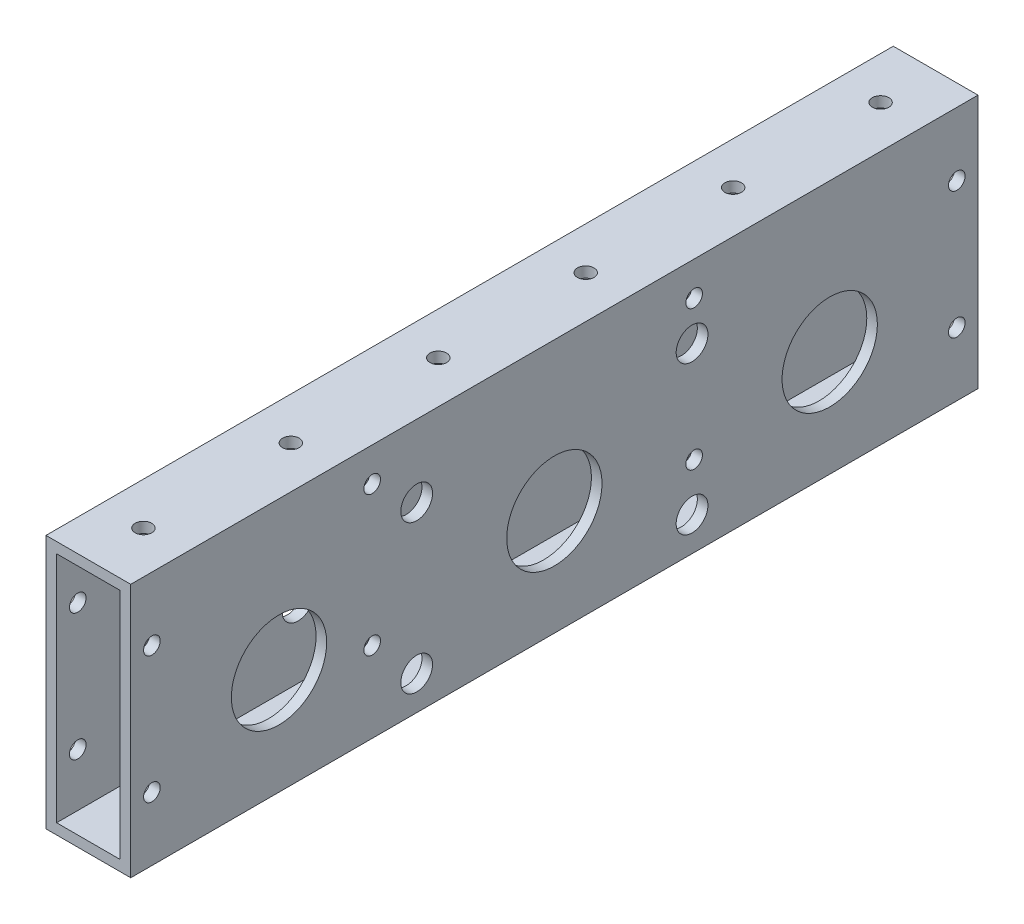
from build123d import *

# Parameters (mm, degrees)
SKETCH1_W                        = 254
SKETCH1_H                        = 76.2
BOSS_EXTRUDE1_DEPTH              = 25.4
SHELL1_T                         = -3.175
SKETCH2_R                        = 14.2875
SKETCH2_R_2                      = 2.4892
CUT_EXTRUDE1_DEPTH               = 136.002851822
F_10_CLEARANCE_HOLE1_D           = 4.9784
F_3_8_0_375_DIAMETER_HOLE1_D     = 9.525
F_3_8_0_375_DIAMETER_HOLE1_DEPTH = 10.922
F_3_8_0_375_DIAMETER_HOLE1_TIP   = 2.861598698
F_3_8_0_375_DIAMETER_HOLE2_D     = 9.525
F_3_8_0_375_DIAMETER_HOLE2_DEPTH = 10.922
F_3_8_0_375_DIAMETER_HOLE2_TIP   = 2.861598698
SKETCH11_R                       = 2.4892
CUT_EXTRUDE2_DEPTH               = 151.268426491


with BuildPart() as part:
    # Sketch1 → Boss-Extrude1 (new body)
    with BuildSketch(Plane(origin=(0, 0, 0), x_dir=(0, 0, -1), z_dir=(1, 0, 0))):
        Rectangle(SKETCH1_W, SKETCH1_H)
    extrude(amount=BOSS_EXTRUDE1_DEPTH)

    # Shell1
    shell1_openings = [part.faces().sort_by_distance(p)[0] for p in [
        (12.7, 0, -127),
        (12.7, 0, 127),
    ]]
    offset(amount=SHELL1_T, openings=shell1_openings, kind=Kind.INTERSECTION)

    # Sketch2 → Cut-Extrude1 (cut, through all)
    with BuildSketch(Plane(origin=(25.4, 0, 0), x_dir=(0, 0, -1), z_dir=(1, 0, 0))):
        with Locations((0, -6.35)):
            Circle(SKETCH2_R)
        with Locations((-82.55, -6.35)):
            Circle(SKETCH2_R)
        with Locations((82.55, -6.35)):
            Circle(SKETCH2_R)
        with Locations((-41.275, 16.51)):
            Circle(SKETCH2_R_2)
        with Locations((-41.275, -27.94)):
            Circle(SKETCH2_R_2)
        with Locations((41.275, -27.94)):
            Circle(SKETCH2_R_2)
        with Locations((41.275, 16.51)):
            Circle(SKETCH2_R_2)
        with Locations((-54.61, 27.94)):
            Circle(SKETCH2_R_2)
        with Locations((-54.61, -13.97)):
            Circle(SKETCH2_R_2)
        with Locations((41.91, -13.97)):
            Circle(SKETCH2_R_2)
        with Locations((41.91, 27.94)):
            Circle(SKETCH2_R_2)
    extrude(amount=-CUT_EXTRUDE1_DEPTH, mode=Mode.SUBTRACT)

    # #10 Clearance Hole1 (through all)
    with Locations(Plane(origin=(25.4, 0, 0), x_dir=(0, 0, -1), z_dir=(1, 0, 0))):
        with Locations((-120.65, 19.05), (-120.65, -19.05)):
            f_10_clearance_hole1 = Hole(F_10_CLEARANCE_HOLE1_D / 2)

    # Mirror1: #10 Clearance Hole1 across plane
    add(f_10_clearance_hole1.mirror(Plane.XY), mode=Mode.SUBTRACT)

    # 3/8 (0.375) Diameter Hole1
    with Locations(Plane.ZY):
        with Locations((54.61, 27.94), (54.61, -13.97), (-41.91, -13.97), (-41.91, 27.94)):
            Hole(F_3_8_0_375_DIAMETER_HOLE1_D / 2, depth=F_3_8_0_375_DIAMETER_HOLE1_DEPTH)
            with Locations((0, 0, -(F_3_8_0_375_DIAMETER_HOLE1_DEPTH + F_3_8_0_375_DIAMETER_HOLE1_TIP / 2))):  # 118° drill point
                Cone(0, F_3_8_0_375_DIAMETER_HOLE1_D / 2, F_3_8_0_375_DIAMETER_HOLE1_TIP, mode=Mode.SUBTRACT)

    # 3/8 (0.375) Diameter Hole2
    with Locations(Plane(origin=(25.4, 0, 0), x_dir=(0, 0, -1), z_dir=(1, 0, 0))):
        with Locations((-41.275, 16.51), (-41.275, -27.94), (41.275, 16.51), (41.275, -27.94)):
            Hole(F_3_8_0_375_DIAMETER_HOLE2_D / 2, depth=F_3_8_0_375_DIAMETER_HOLE2_DEPTH)
            with Locations((0, 0, -(F_3_8_0_375_DIAMETER_HOLE2_DEPTH + F_3_8_0_375_DIAMETER_HOLE2_TIP / 2))):  # 118° drill point
                Cone(0, F_3_8_0_375_DIAMETER_HOLE2_D / 2, F_3_8_0_375_DIAMETER_HOLE2_TIP, mode=Mode.SUBTRACT)

    # Sketch11 → Cut-Extrude2 (cut, through all)
    with BuildSketch(Plane.XZ.offset(38.1)):
        with Locations((12.7, -110.49)):
            Circle(SKETCH11_R)
        with Locations((12.7, -66.294)):
            Circle(SKETCH11_R)
        with Locations((12.7, -22.098)):
            Circle(SKETCH11_R)
        with Locations((12.7, 22.098)):
            Circle(SKETCH11_R)
        with Locations((12.7, 66.294)):
            Circle(SKETCH11_R)
        with Locations((12.7, 110.49)):
            Circle(SKETCH11_R)
    extrude(amount=-CUT_EXTRUDE2_DEPTH, mode=Mode.SUBTRACT)


solid = part.part
